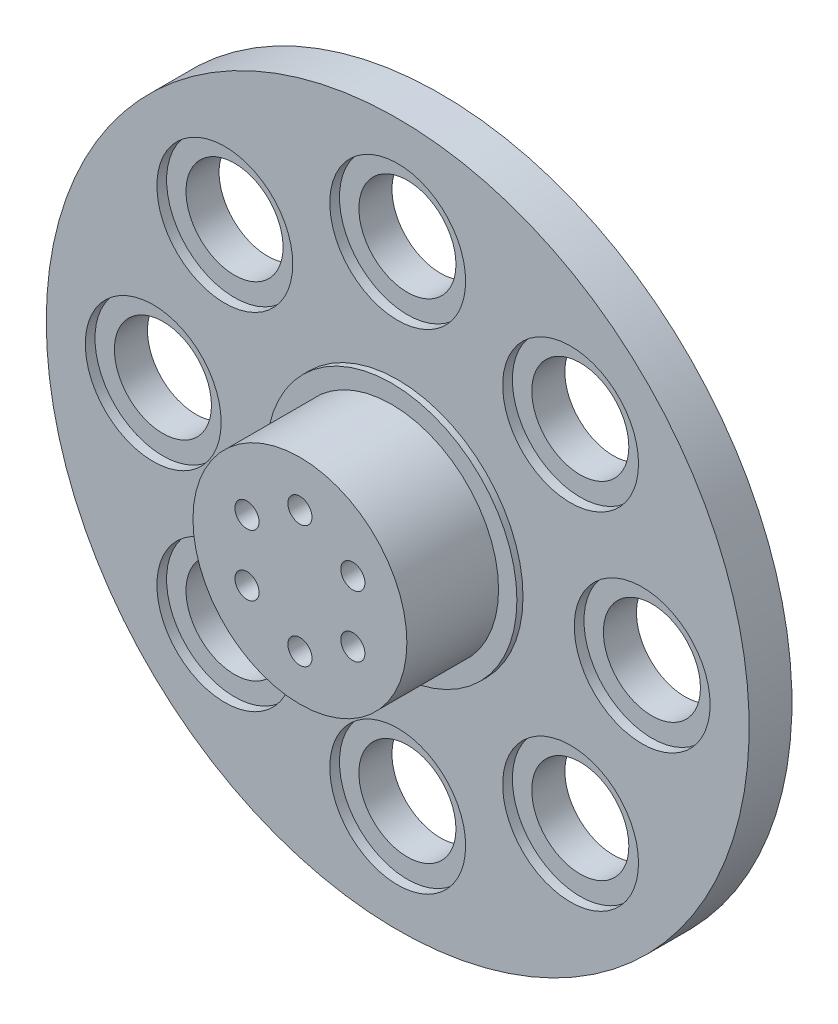
from build123d import *

# Parameters (mm, degrees)
SKETCH1_R           = 17.5
BOSS_EXTRUDE1_DEPTH = 15
SKETCH7_R           = 20.5
BOSS_EXTRUDE3_DEPTH = 1
SKETCH3_R           = 57.5
BOSS_EXTRUDE2_DEPTH = 7
SKETCH4_R           = 11
CUT_EXTRUDE1_DEPTH  = 7
SKETCH5_R           = 7.5
CUT_EXTRUDE2_DEPTH  = 0.5
SKETCH6_R           = 1.975
CUT_EXTRUDE3_DEPTH  = 6
CIRPATTERN1_COUNT   = 6
SKETCH8_R           = 7.94
CUT_EXTRUDE4_DEPTH  = 83.876414015
SKETCH9_R           = 11.1125
CUT_EXTRUDE5_DEPTH  = 1.5875


with BuildPart() as part:
    # Sketch1 → Boss-Extrude1 (new body)
    with BuildSketch(Plane.XY):
        Circle(SKETCH1_R)
    extrude(amount=BOSS_EXTRUDE1_DEPTH)

    # Sketch7 → Boss-Extrude3 (add)
    with BuildSketch(Plane(origin=(0, 0, 0), x_dir=(-1, 0, 0), z_dir=(0, 0, -1))):
        Circle(SKETCH7_R)
    extrude(amount=BOSS_EXTRUDE3_DEPTH)

    # Sketch3 → Boss-Extrude2 (add)
    with BuildSketch(Plane(origin=(0, 0, -1), x_dir=(-1, 0, 0), z_dir=(0, 0, -1))):
        Circle(SKETCH3_R)
    extrude(amount=BOSS_EXTRUDE2_DEPTH)

    # Sketch4 → Cut-Extrude1 (cut)
    with BuildSketch(Plane(origin=(0, 0, -8), x_dir=(-1, 0, 0), z_dir=(0, 0, -1))):
        Circle(SKETCH4_R)
    extrude(amount=-CUT_EXTRUDE1_DEPTH, mode=Mode.SUBTRACT)

    # Sketch5 → Cut-Extrude2 (cut)
    with BuildSketch(Plane(origin=(0, 0, -1), x_dir=(-1, 0, 0), z_dir=(0, 0, -1))):
        Circle(SKETCH5_R)
    extrude(amount=-CUT_EXTRUDE2_DEPTH, mode=Mode.SUBTRACT)

    # Sketch6 → Cut-Extrude3 (cut)
    with BuildSketch(Plane.XY.offset(15)):
        with Locations((0, 10)):
            Circle(SKETCH6_R)
    cut_extrude3 = extrude(amount=-CUT_EXTRUDE3_DEPTH, mode=Mode.SUBTRACT)

    # CirPattern1: Cut-Extrude3 ×6 about axis
    cirpattern1_axis = Axis((0, 0, 15), (0, 0, 1))
    for i in range(1, CIRPATTERN1_COUNT):
        add(cut_extrude3.rotate(cirpattern1_axis, i * 360 / CIRPATTERN1_COUNT), mode=Mode.SUBTRACT)

    # Sketch8 → Cut-Extrude4 (cut, through all)
    with BuildSketch(Plane.XY.offset(-1)):
        with Locations((-40, 0)):
            Circle(SKETCH8_R)
        with Locations((-28.284271247, 28.284271247)):
            Circle(SKETCH8_R)
        with Locations((0, 40)):
            Circle(SKETCH8_R)
        with Locations((28.284271247, 28.284271247)):
            Circle(SKETCH8_R)
        with Locations((40, 0)):
            Circle(SKETCH8_R)
        with Locations((28.284271247, -28.284271247)):
            Circle(SKETCH8_R)
        with Locations((0, -40)):
            Circle(SKETCH8_R)
        with Locations((-28.284271247, -28.284271247)):
            Circle(SKETCH8_R)
    extrude(amount=-CUT_EXTRUDE4_DEPTH, mode=Mode.SUBTRACT)

    # Sketch9 → Cut-Extrude5 (cut)
    with BuildSketch(Plane.XY.offset(-1)):
        with Locations((0, 40)):
            Circle(SKETCH9_R)
        with Locations((28.284271247, 28.284271247)):
            Circle(SKETCH9_R)
        with Locations((40, 0)):
            Circle(SKETCH9_R)
        with Locations((28.284271247, -28.284271247)):
            Circle(SKETCH9_R)
        with Locations((0, -40)):
            Circle(SKETCH9_R)
        with Locations((-28.284271247, -28.284271247)):
            Circle(SKETCH9_R)
        with Locations((-40, 0)):
            Circle(SKETCH9_R)
        with Locations((-28.284271247, 28.284271247)):
            Circle(SKETCH9_R)
    extrude(amount=-CUT_EXTRUDE5_DEPTH, mode=Mode.SUBTRACT)


solid = part.part
